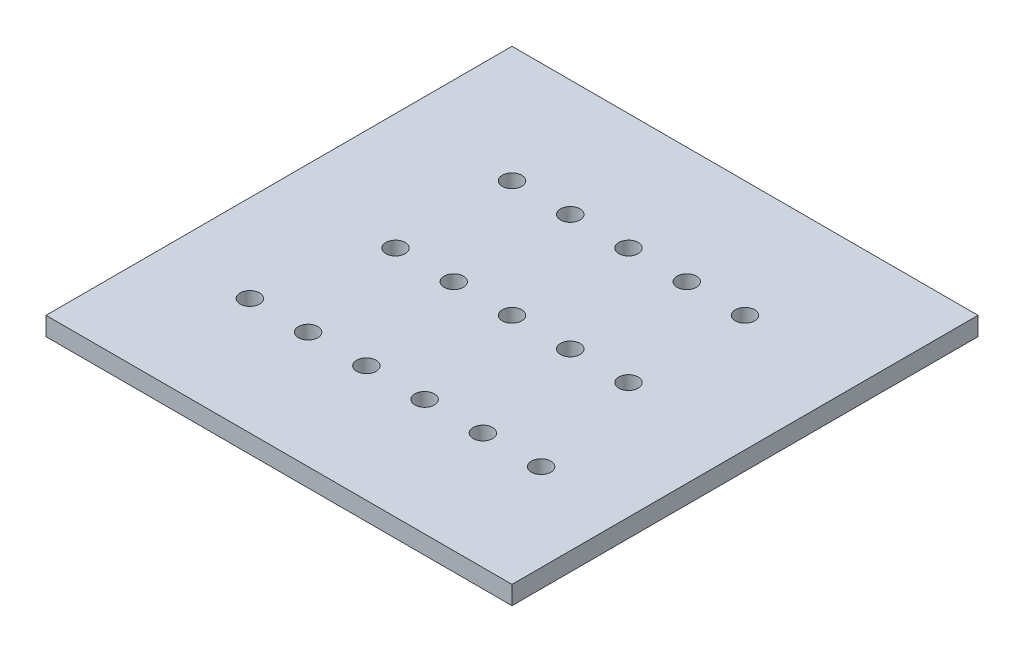
from build123d import *

# Parameters (mm, degrees)
SKETCH1_W           = 120
SKETCH1_H           = 120
SKETCH1_R           = 2.5
BOSS_EXTRUDE1_DEPTH = 4.7625


with BuildPart() as part:
    # Sketch1 → Boss-Extrude1 (new body)
    with BuildSketch(Plane(origin=(0, 0, 0), x_dir=(1, 0, 0), z_dir=(0, 1, 0))):
        with Locations((60, 60)):
            Rectangle(SKETCH1_W, SKETCH1_H)
        with Locations((30, 90)):
            Circle(SKETCH1_R, mode=Mode.SUBTRACT)
        with Locations((45, 90)):
            Circle(SKETCH1_R, mode=Mode.SUBTRACT)
        with Locations((60, 90)):
            Circle(SKETCH1_R, mode=Mode.SUBTRACT)
        with Locations((75, 90)):
            Circle(SKETCH1_R, mode=Mode.SUBTRACT)
        with Locations((90, 90)):
            Circle(SKETCH1_R, mode=Mode.SUBTRACT)
        with Locations((90, 60)):
            Circle(SKETCH1_R, mode=Mode.SUBTRACT)
        with Locations((75, 60)):
            Circle(SKETCH1_R, mode=Mode.SUBTRACT)
        with Locations((60, 60)):
            Circle(SKETCH1_R, mode=Mode.SUBTRACT)
        with Locations((45, 60)):
            Circle(SKETCH1_R, mode=Mode.SUBTRACT)
        with Locations((30, 60)):
            Circle(SKETCH1_R, mode=Mode.SUBTRACT)
        with Locations((22.5, 30)):
            Circle(SKETCH1_R, mode=Mode.SUBTRACT)
        with Locations((37.5, 30)):
            Circle(SKETCH1_R, mode=Mode.SUBTRACT)
        with Locations((52.5, 30)):
            Circle(SKETCH1_R, mode=Mode.SUBTRACT)
        with Locations((67.5, 30)):
            Circle(SKETCH1_R, mode=Mode.SUBTRACT)
        with Locations((82.5, 30)):
            Circle(SKETCH1_R, mode=Mode.SUBTRACT)
        with Locations((97.5, 30)):
            Circle(SKETCH1_R, mode=Mode.SUBTRACT)
    extrude(amount=BOSS_EXTRUDE1_DEPTH)


solid = part.part
